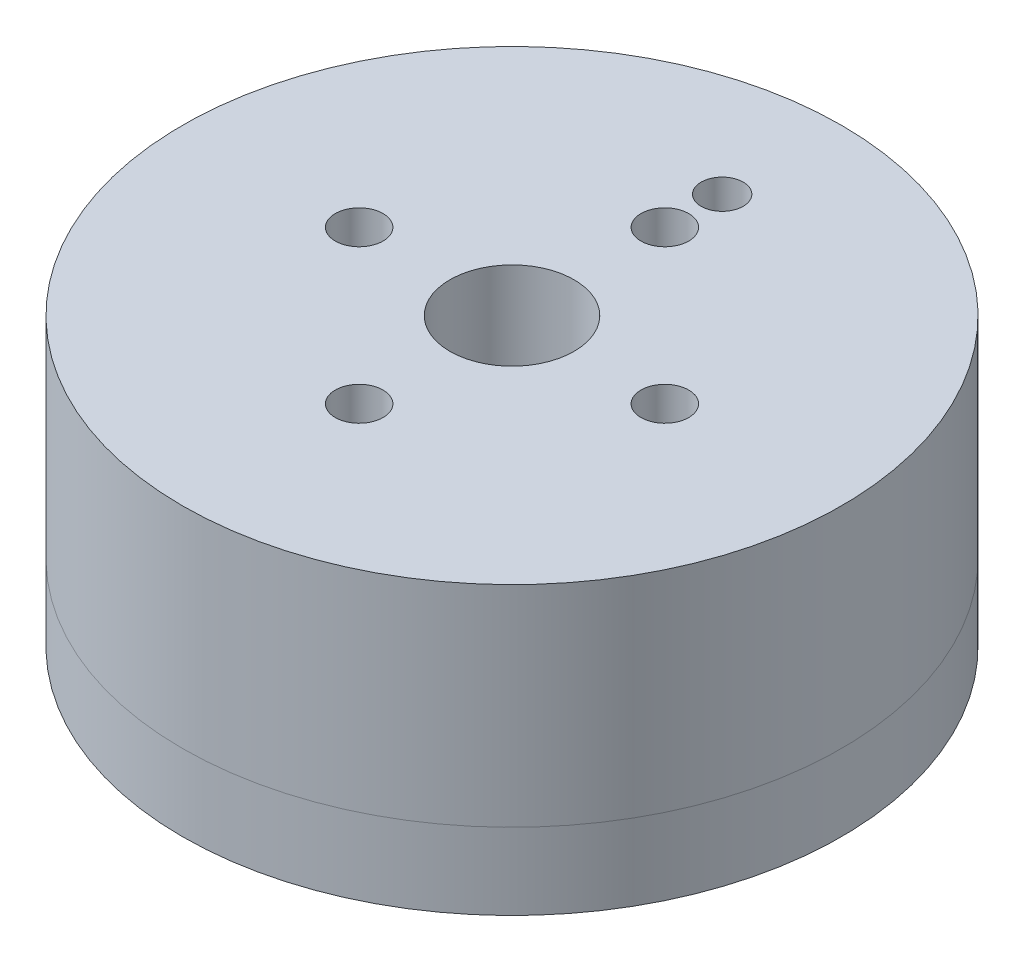
from build123d import *

# Parameters (mm, degrees)
SKETCH1_R           = 17.25
BOSS_EXTRUDE1_DEPTH = 11
SKETCH2_R           = 1.25
SKETCH2_R_2         = 1.1
CUT_EXTRUDE1_DEPTH  = 3
SKETCH1_2_R         = 17.25
BOSS_EXTRUDE2_DEPTH = 4
SKETCH4_R           = 1.25
SKETCH4_R_2         = 1.1
CUT_EXTRUDE3_DEPTH  = 4
SKETCH5_R           = 5
BOSS_EXTRUDE3_DEPTH = 4.5
BOSS_EXTRUDE4_START = 4.5
SKETCH5_3_R         = 6
SKETCH5_3_R_2       = 5
BOSS_EXTRUDE4_DEPTH = 2.5
CUT_EXTRUDE4_START  = 4.5
SKETCH5_5_R         = 2.7
CUT_EXTRUDE4_DEPTH  = 2.5
CUT_EXTRUDE5_START  = -6
SKETCH6_R           = 3.25
CUT_EXTRUDE5_DEPTH  = 17
FILLET1_R           = 2


with BuildPart() as part:
    # Sketch1 → Boss-Extrude1 (new body)
    with BuildSketch(Plane(origin=(0, 0, 0), x_dir=(1, 0, 0), z_dir=(0, 1, 0))):
        with Locations(Location((0, 0, 0), (0, 0, 270))):
            Circle(SKETCH1_R)
    extrude(amount=BOSS_EXTRUDE1_DEPTH)

    # Sketch2 → Cut-Extrude1 (cut)
    with BuildSketch(Plane(origin=(0, 11, 0), x_dir=(1, 0, 0), z_dir=(0, 1, 0))):
        with Locations(Location((0, 8, 0), (0, 0, 270))):
            Circle(SKETCH2_R)
        with Locations(Location((0, 11, 0), (0, 0, 270))):
            Circle(SKETCH2_R_2)
        with Locations(Location((8, 0, 0), (0, 0, 270))):
            Circle(SKETCH2_R)
        with Locations(Location((0, -8, 0), (0, 0, 270))):
            Circle(SKETCH2_R)
        with Locations(Location((-8, 0, 0), (0, 0, 270))):
            Circle(SKETCH2_R)
    extrude(amount=-CUT_EXTRUDE1_DEPTH, mode=Mode.SUBTRACT)


with BuildPart() as body_2:
    # Sketch1<2> → Boss-Extrude2 (new body)
    with BuildSketch(Plane(origin=(0, 0, 0), x_dir=(1, 0, 0), z_dir=(0, 1, 0))):
        with Locations(Location((0, 0, 0), (0, 0, 270))):
            Circle(SKETCH1_2_R)
    extrude(amount=-BOSS_EXTRUDE2_DEPTH)

    # Sketch4 → Cut-Extrude3 (cut)
    with BuildSketch(Plane.XZ.offset(4)):
        with Locations(Location((-6.7, 6.7, 0), (0, 0, 270))):
            Circle(SKETCH4_R)
        with Locations(Location((6.7, 6.7, 0), (0, 0, 270))):
            Circle(SKETCH4_R)
        with Locations(Location((6.7, -6.7, 0), (0, 0, 270))):
            Circle(SKETCH4_R)
        with Locations(Location((-6.7, -6.7, 0), (0, 0, 270))):
            Circle(SKETCH4_R)
        with Locations(Location((13.167391572, 0, 0), (0, 0, 270))):
            Circle(SKETCH4_R_2)
    extrude(amount=-CUT_EXTRUDE3_DEPTH, mode=Mode.SUBTRACT)

    # Sketch5 → Boss-Extrude3 (add)
    with BuildSketch(Plane.XZ.offset(4)):
        with Locations(Location((0, 0, 0), (0, 0, 90))):
            Circle(SKETCH5_R)
    extrude(amount=BOSS_EXTRUDE3_DEPTH)

    # Sketch5<3> → Boss-Extrude4 (add)
    with BuildSketch(Plane.XZ.offset(4).offset(BOSS_EXTRUDE4_START)):
        with Locations(Location((0, 0, 0), (0, 0, 270))):
            Circle(SKETCH5_3_R)
        with Locations(Location((0, 0, 0), (0, 0, 90))):
            Circle(SKETCH5_3_R_2, mode=Mode.SUBTRACT)
    extrude(amount=-BOSS_EXTRUDE4_DEPTH)

    # Sketch5<5> → Cut-Extrude4 (cut)
    with BuildSketch(Plane.XZ.offset(4).offset(CUT_EXTRUDE4_START)):
        with Locations(Location((0, 0, 0), (0, 0, 270))):
            Circle(SKETCH5_5_R)
    extrude(amount=-CUT_EXTRUDE4_DEPTH, mode=Mode.SUBTRACT)


with BuildPart() as cut_extrude5_tool:
    # Sketch6 → Cut-Extrude5 (new body)
    with BuildSketch(Plane(origin=(0, 0, 0), x_dir=(1, 0, 0), z_dir=(0, 1, 0)).offset(CUT_EXTRUDE5_START)):
        with Locations(Location((0, 0, 0), (0, 0, 90))):
            Circle(SKETCH6_R)
    extrude(amount=CUT_EXTRUDE5_DEPTH)


with BuildPart() as part_1:
    add(part.part)

    # Cut-Extrude5: cut by cut_extrude5_tool
    add(cut_extrude5_tool.part, mode=Mode.SUBTRACT)


with BuildPart() as body_2_1:
    add(body_2.part)

    # Cut-Extrude5: cut by cut_extrude5_tool
    add(cut_extrude5_tool.part, mode=Mode.SUBTRACT)

    # Fillet1
    # the kernel refuses this fillet: 2 mm, written as the material it adds along each edge
    with BuildSketch(Plane(origin=(0, -6, 0), x_dir=(0, 0, 1), z_dir=(1, 0, 0))) as fillet1_piece_1:
        with BuildLine():
            CenterArc((7, -1.732050808), FILLET1_R, 120, 60)
            Line((6, 0), (5.98, 0.034641016))
            ThreePointArc((5.98, 0.034641016), (5.5, 0.04), (5, 0.04))
            Line((5, 0.04), (4.96, 0))
            Line((4.96, 0), (4.96, -1.732050808))
            Line((4.96, -1.732050808), (5, -1.732050808))
        make_face()
    revolve(axis=Axis((0, -6, 0), (0, -1, 0)))


solid = Compound([part_1.part, body_2_1.part])
